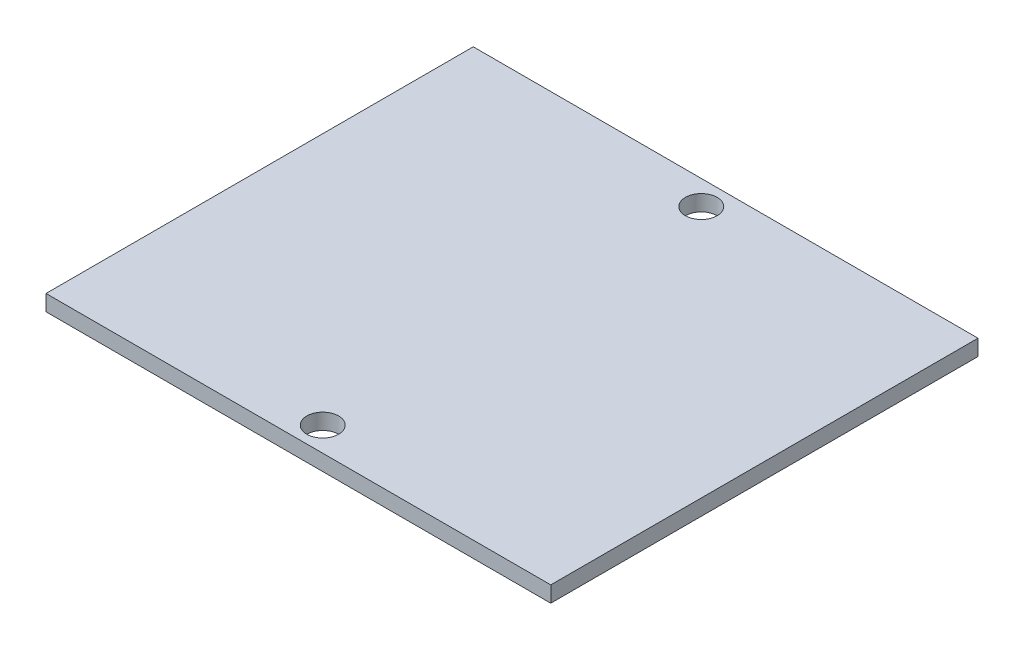
from build123d import *

# Parameters (mm, degrees)
SKETCH1_W           = 50.8
SKETCH1_H           = 43
SKETCH1_R           = 1.599999975
BOSS_EXTRUDE1_DEPTH = 1.6002


with BuildPart() as part:
    # Sketch1 → Boss-Extrude1 (new body)
    with BuildSketch(Plane(origin=(0, 0, 0), x_dir=(1, 0, 0), z_dir=(0, 1, 0))):
        with Locations((25.4, 21.5)):
            Rectangle(SKETCH1_W, SKETCH1_H)
        with Locations((25.4, 40.55)):
            Circle(SKETCH1_R, mode=Mode.SUBTRACT)
        with Locations((25.4, 2.45)):
            Circle(SKETCH1_R, mode=Mode.SUBTRACT)
    extrude(amount=BOSS_EXTRUDE1_DEPTH)


solid = part.part
